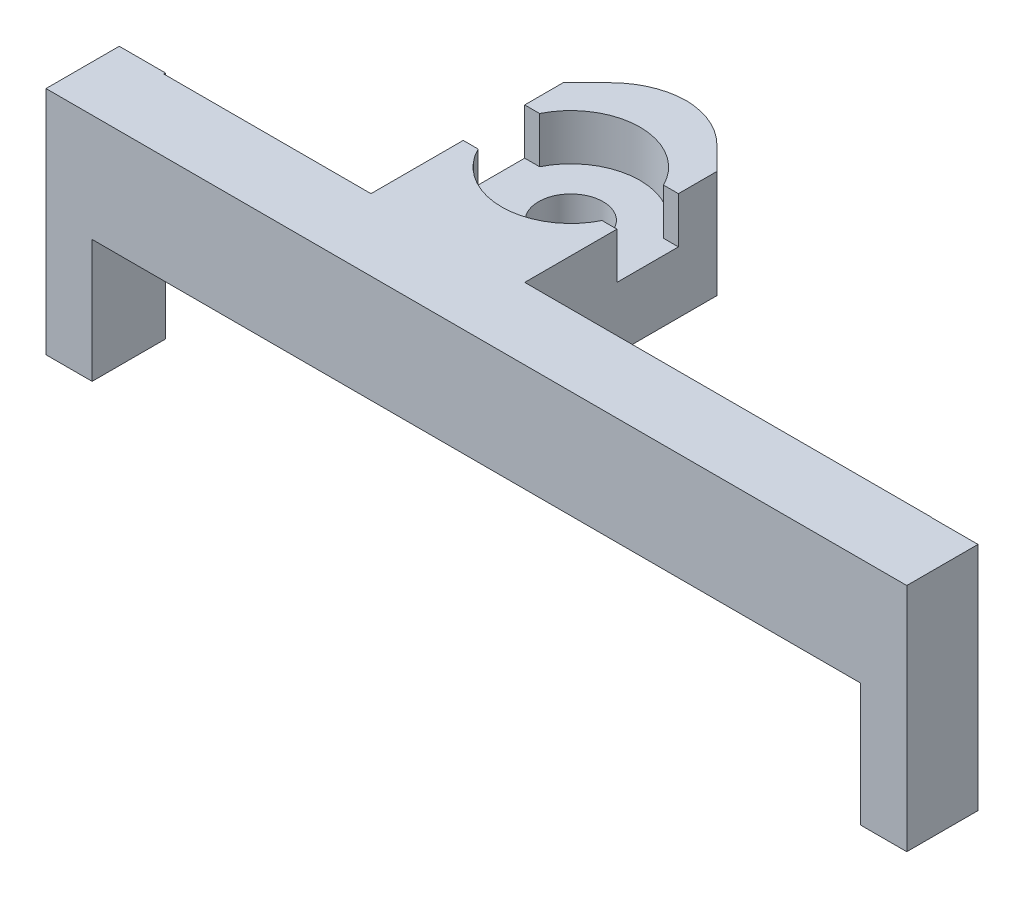
from build123d import *

# Parameters (mm, degrees)
SKETCH1_W           = 50
SKETCH1_H           = 100
BOSS_EXTRUDE1_DEPTH = 7
CUT_EXTRUDE1_DEPTH  = 10
CUT_EXTRUDE2_DEPTH  = 28
SKETCH5_W           = 3
SKETCH5_H           = 4.633494333
SKETCH5_H_2         = 4.765216978
BOSS_EXTRUDE2_DEPTH = 15
SKETCH6_R           = 2.1
CUT_EXTRUDE3_DEPTH  = 15
CHAMFER1_SIZE       = 3
CUT_EXTRUDE4_DEPTH  = 3
FILLET1_R           = 5
SKETCH8_W           = 66.498468349
SKETCH8_H           = 65.695900627
CUT_EXTRUDE5_DEPTH  = 29


with BuildPart() as part:
    # Sketch1 → Boss-Extrude1 (new body)
    with BuildSketch(Plane(origin=(0, 0, 0), x_dir=(1, 0, 0), z_dir=(0, 1, 0))):
        with Locations((-16.984615004, 32.878894954)):
            Rectangle(SKETCH1_W, SKETCH1_H)
    extrude(amount=BOSS_EXTRUDE1_DEPTH)

    # Sketch2 → Cut-Extrude1 (cut)
    with BuildSketch(Plane.XZ):
        Polygon((8.015384996, -49.878894954), (6.015384996, -49.878894954), (-18.491384598, -49.878894954), (-18.491384598, -50.378894954), (-18.491384598, -65.378894954), (-28.491384598, -65.378894954), (-28.491384598, -50.378894954), (-28.491384598, -49.878894954), (-39.984615004, -49.878894954), (-41.984615004, -49.878894954), (-41.984615004, -82.878894954), (8.015384996, -82.878894954), align=None)
    extrude(amount=-CUT_EXTRUDE1_DEPTH, mode=Mode.SUBTRACT)

    # Sketch4 → Cut-Extrude2 (cut)
    with BuildSketch(Plane.XZ):
        Polygon((8.015384996, -42.228894954), (-0.484615004, -42.228894954), (-33.484615004, -42.228894954), (-41.984615004, -42.228894954), (-41.984615004, -45.228894954), (-33.484615004, -45.228894954), (-0.484615004, -45.228894954), (8.015384996, -45.228894954), align=None)
    extrude(amount=-CUT_EXTRUDE2_DEPTH, mode=Mode.SUBTRACT)


with BuildPart() as cut_extrude2_piece_1:
    # of the separate pieces the step leaves, piece 1, a body of its own (cut_extrude2_pieces)
    add(part.part.solids().sort_by_distance((8.015384996, 0, 17.121105046))[0])

    # Sketch8 → Cut-Extrude5 (cut)
    with BuildSketch(Plane(origin=(0, 7, 0), x_dir=(1, 0, 0), z_dir=(0, 1, 0))):
        with Locations((-10.449420701, 11.294291779)):
            Rectangle(SKETCH8_W, SKETCH8_H)
    extrude(amount=-CUT_EXTRUDE5_DEPTH, mode=Mode.SUBTRACT)


with BuildPart() as cut_extrude2_piece_2:
    # of the separate pieces the step leaves, piece 2, a body of its own (cut_extrude2_pieces)
    add(part.part.solids().sort_by_distance((8.015384996, 0, -49.878894954))[0])

    # Sketch5 → Boss-Extrude2 (add)
    with BuildSketch(Plane(origin=(0, 7, 0), x_dir=(1, 0, 0), z_dir=(0, 1, 0))):
        with Locations((9.515384996, 47.545642121)):
            Rectangle(SKETCH5_W, SKETCH5_H)
        with Locations((-43.484615004, 47.611503443)):
            Rectangle(SKETCH5_W, SKETCH5_H_2)
    extrude(amount=-BOSS_EXTRUDE2_DEPTH)

    # Sketch6 → Cut-Extrude3 (cut)
    with BuildSketch(Plane(origin=(0, 7, 0), x_dir=(1, 0, 0), z_dir=(0, 1, 0))):
        with Locations(Location((-23.491299754, 57.878894954, 0), (0, 0, 270))):
            Circle(SKETCH6_R)
    extrude(amount=-CUT_EXTRUDE3_DEPTH, mode=Mode.SUBTRACT)

    # Chamfer1
    chamfer1_edges = [cut_extrude2_piece_2.edges().sort_by_distance(p)[0] for p in [
        (-28.491384598, 3.5, -65.378894954),
        (-18.491384598, 3.5, -65.378894954),
    ]]
    chamfer(chamfer1_edges, length=CHAMFER1_SIZE)

    # Sketch7 → Cut-Extrude4 (cut)
    with BuildSketch(Plane(origin=(0, 7, 0), x_dir=(1, 0, 0), z_dir=(0, 1, 0))):
        with BuildLine():
            Line((-28.491384598, 55.878894954), (-27.522428628, 55.878894954))
            ThreePointArc((-27.522428628, 55.878894954), (-23.491299754, 53.378894954), (-19.46017088, 55.878894954))
            Line((-19.46017088, 55.878894954), (-18.491384598, 55.878894954))
            Line((-18.491384598, 55.878894954), (-18.491384598, 59.878894954))
            Line((-18.491384598, 59.878894954), (-19.46017088, 59.878894954))
            ThreePointArc((-19.46017088, 59.878894954), (-23.491299754, 62.378894954), (-27.522428628, 59.878894954))
            Line((-27.522428628, 59.878894954), (-28.491384598, 59.878894954))
            Line((-28.491384598, 59.878894954), (-28.491384598, 55.878894954))
        make_face()
    extrude(amount=-CUT_EXTRUDE4_DEPTH, mode=Mode.SUBTRACT)

    # Fillet1
    # the kernel refuses this fillet: 5 mm, written as the material it takes off along each edge
    with BuildSketch(Plane(origin=(-21.491384598, -5.17766953, -65.378894954), x_dir=(0.7071067811865483, 0, 0.7071067811865466), z_dir=(0, 1, 0)), Plane(origin=(-25.491384598, -5.17766953, -65.378894954), x_dir=(1, 0, 0), z_dir=(0, 1, 0))) as fillet1_piece_1:
        with BuildLine():
            CenterArc((FILLET1_R * 0.414213562373, -FILLET1_R), FILLET1_R, 90, 45)
            Line((-FILLET1_R * 0.292893218813, -FILLET1_R * 0.292893218813), (0, 0))
            Line((0, 0), (FILLET1_R * 0.414213562373, 0))
        make_face()
    extrude(amount=17.355339059, mode=Mode.SUBTRACT)


solid = cut_extrude2_piece_2.part
